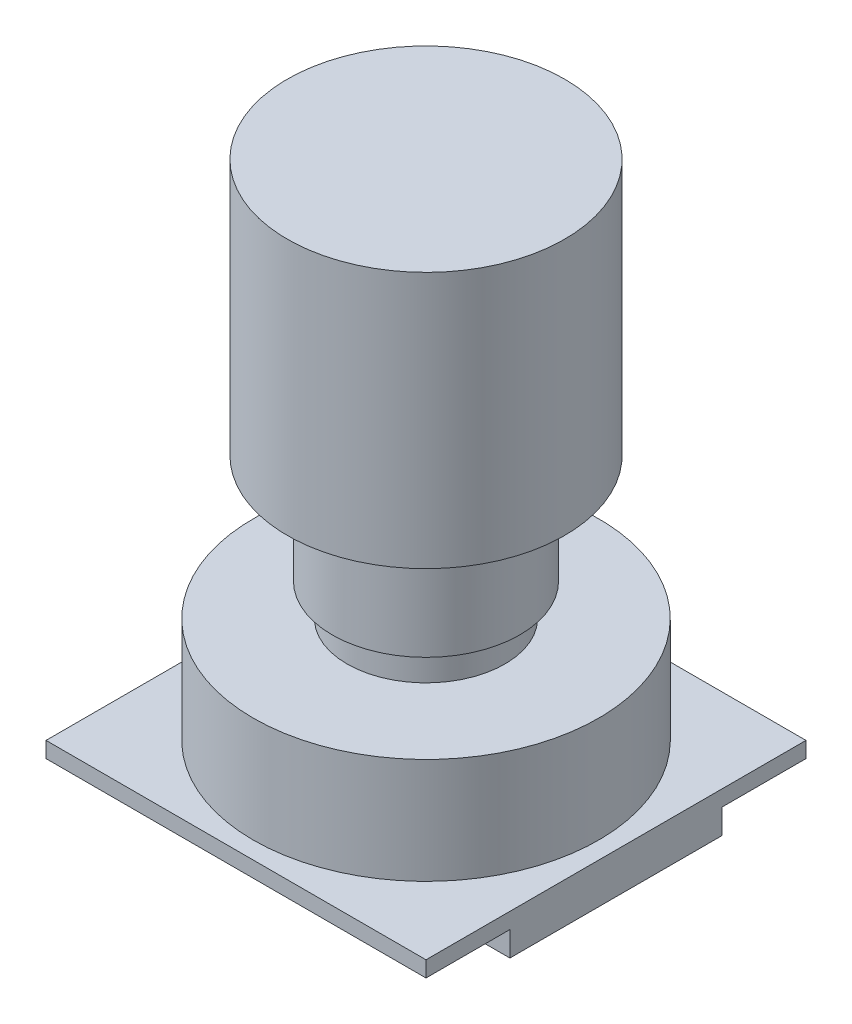
from build123d import *

# Parameters (mm, degrees)
SKETCH1_W           = 38.5
SKETCH1_H           = 38.5
BOSS_EXTRUDE1_DEPTH = 1.6
SKETCH2_R           = 17.5
BOSS_EXTRUDE2_DEPTH = 10.7
SKETCH3_R           = 8
BOSS_EXTRUDE3_DEPTH = 3.3
SKETCH4_R           = 9.5
BOSS_EXTRUDE4_DEPTH = 11
SKETCH5_R           = 14.05
BOSS_EXTRUDE5_DEPTH = 26
SKETCH7_W           = 6
SKETCH7_H           = 21.5
BOSS_EXTRUDE6_DEPTH = 2.5


with BuildPart() as part:
    # Sketch1 → Boss-Extrude1 (new body)
    with BuildSketch(Plane(origin=(0, 0, 0), x_dir=(1, 0, 0), z_dir=(0, 1, 0))):
        Rectangle(SKETCH1_W, SKETCH1_H)
    extrude(amount=BOSS_EXTRUDE1_DEPTH)

    # Sketch2 → Boss-Extrude2 (add)
    with BuildSketch(Plane(origin=(0, 1.6, 0), x_dir=(1, 0, 0), z_dir=(0, 1, 0))):
        Circle(SKETCH2_R)
    extrude(amount=BOSS_EXTRUDE2_DEPTH)

    # Sketch3 → Boss-Extrude3 (add)
    with BuildSketch(Plane(origin=(0, 12.3, 0), x_dir=(1, 0, 0), z_dir=(0, 1, 0))):
        Circle(SKETCH3_R)
    extrude(amount=BOSS_EXTRUDE3_DEPTH)

    # Sketch4 → Boss-Extrude4 (add)
    with BuildSketch(Plane(origin=(0, 15.6, 0), x_dir=(1, 0, 0), z_dir=(0, 1, 0))):
        Circle(SKETCH4_R)
    extrude(amount=BOSS_EXTRUDE4_DEPTH)

    # Sketch5 → Boss-Extrude5 (add)
    with BuildSketch(Plane(origin=(0, 26.6, 0), x_dir=(1, 0, 0), z_dir=(0, 1, 0))):
        Circle(SKETCH5_R)
    extrude(amount=BOSS_EXTRUDE5_DEPTH)

    # Sketch7 → Boss-Extrude6 (add)
    with BuildSketch(Plane.XZ):
        with Locations((16.25, 0)):
            Rectangle(SKETCH7_W, SKETCH7_H)
    extrude(amount=BOSS_EXTRUDE6_DEPTH)


solid = part.part
